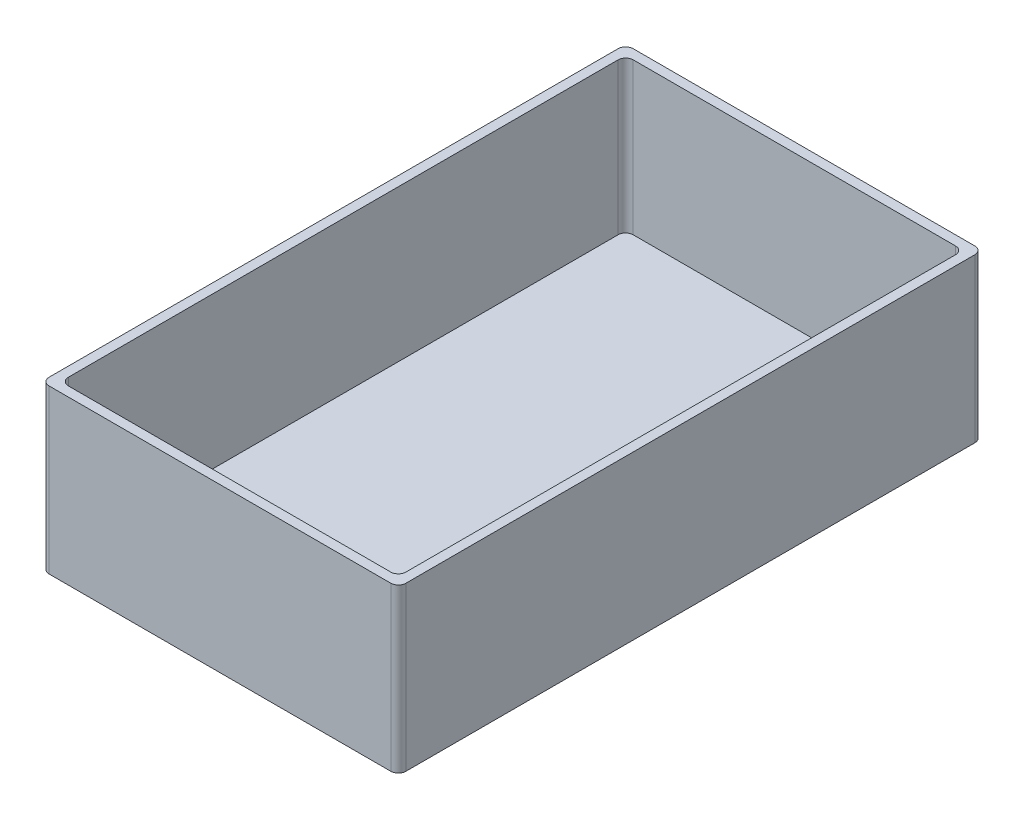
from build123d import *

# Parameters (mm, degrees)
SKETCH1_W           = 47.09116882
SKETCH1_H           = 77.09116882
BOSS_EXTRUDE1_DEPTH = 1.5
SKETCH2_W           = 47.09116882
SKETCH2_H           = 77.09116882
SKETCH2_W_2         = 44.545584412
SKETCH2_H_2         = 74.545584412
BOSS_EXTRUDE2_DEPTH = 20
FILLET4_R           = 1
SKETCH5_W           = 8.4
SKETCH5_H           = 2.6
CUT_EXTRUDE1_DEPTH  = 10
FILLET8_R           = 1
CUT_EXTRUDE2_DEPTH  = 1


with BuildPart() as part:
    # Sketch1 → Boss-Extrude1 (new body)
    with BuildSketch(Plane(origin=(0, 0, 0), x_dir=(1, 0, 0), z_dir=(0, 1, 0))):
        with Locations((23.54558441, -38.54558441)):
            Rectangle(SKETCH1_W, SKETCH1_H)
    extrude(amount=BOSS_EXTRUDE1_DEPTH)

    # Sketch2 → Boss-Extrude2 (add)
    with BuildSketch(Plane(origin=(0, 1.5, 0), x_dir=(1, 0, 0), z_dir=(0, 1, 0))):
        with Locations((23.54558441, -38.54558441)):
            Rectangle(SKETCH2_W, SKETCH2_H)
        with Locations((23.545584412, -38.545584412)):
            Rectangle(SKETCH2_W_2, SKETCH2_H_2, mode=Mode.SUBTRACT)
    extrude(amount=BOSS_EXTRUDE2_DEPTH)

    # Fillet4
    fillet4_edges = [part.edges().sort_by_distance(p)[0] for p in [
        (45.818376618, 11.5, 1.272792206),
        (1.272792206, 11.5, 1.272792206),
        (45.818376618, 11.5, 75.818376618),
        (1.272792206, 11.5, 75.818376618),
        (47.09116882, 10.75, 0),
        (0, 10.75, 0),
        (47.09116882, 10.75, 77.09116882),
        (0, 10.75, 77.09116882),
    ]]
    fillet(fillet4_edges, radius=FILLET4_R)

    # Sketch5 → Cut-Extrude1 (cut)
    with BuildSketch(Plane(origin=(0, 0, 0), x_dir=(-1, 0, 0), z_dir=(0, 0, -1))):
        with Locations((-40.003376618, 2.8)):
            Rectangle(SKETCH5_W, SKETCH5_H)
    extrude(amount=-CUT_EXTRUDE1_DEPTH, mode=Mode.SUBTRACT)

    # Fillet8
    fillet8_edges = [part.edges().sort_by_distance(p)[0] for p in [
        (35.803376618, 1.5, 0.636396103),
        (35.803376618, 4.1, 0.636396103),
        (44.203376618, 1.5, 0.636396103),
        (44.203376618, 4.1, 0.636396103),
    ]]
    fillet(fillet8_edges, radius=FILLET8_R)

    # Sketch7 → Cut-Extrude2 (cut)
    # profile 1 of 5: a face of its own
    with BuildSketch(Plane.ZY):
        with BuildLine():
            Line((23.122789015, 9.088724455), (23.122789015, 9.331051528))
            add(Edge.make_bspline(
                [(23.122789015, 9.331051528), (23.158172229, 9.332621621), (23.226621675, 9.335658995), (23.32478923, 9.348698008), (23.415271878, 9.365833728), (23.497766696, 9.389731154), (23.572170054, 9.419873563), (23.638898118, 9.455406262), (23.697605822, 9.496851961), (23.747389395, 9.546088791), (23.791713125, 9.601633591), (23.828671389, 9.665740351), (23.860744432, 9.738066215), (23.887333242, 9.818241108), (23.905169621, 9.908265731), (23.920683874, 10.005416618), (23.929529373, 10.111722199), (23.930197206, 10.185070567), (23.930545924, 10.223370488)],
                knots=[0, 0, 0, 0, 1.21933905, 2.358832743, 3.407453553, 4.388736407, 5.311689626, 6.167476111, 6.987811037, 7.776833803, 8.571160983, 9.42854077, 10.317186896, 11.293213319, 12.330560473, 13.474100807, 14.681064853, 16, 16, 16, 16], degree=3))
            Line((23.930545924, 10.223370488), (23.930545924, 13.896140183))
            add(Edge.make_bspline(
                [(23.930545924, 13.896140183), (23.930162606, 13.932333722), (23.929421448, 14.002315177), (23.920927581, 14.103216172), (23.905025382, 14.195247238), (23.887491472, 14.279961807), (23.860097102, 14.355569163), (23.829466302, 14.424460378), (23.790878128, 14.484249002), (23.747405247, 14.536947671), (23.697468763, 14.583647188), (23.638453989, 14.622324259), (23.57213896, 14.656765529), (23.4976997, 14.685648969), (23.415068701, 14.707908229), (23.324816258, 14.725482673), (23.226614113, 14.7383856), (23.158169652, 14.741442585), (23.122789015, 14.743022817)],
                knots=[0, 0, 0, 0, 1.282551141, 2.479856758, 3.582846709, 4.591957795, 5.539728447, 6.426928982, 7.258250827, 8.052375152, 8.843695357, 9.670727864, 10.544293885, 11.48842219, 12.49400259, 13.572949607, 14.745397557, 16, 16, 16, 16], degree=3))
            Line((23.122789015, 14.743022817), (23.122789015, 14.985349889))
            Line((23.122789015, 14.985349889), (26.663036092, 14.985349889))
            add(Edge.make_bspline(
                [(26.663036092, 14.985349889), (26.754786807, 14.984709338), (26.932163643, 14.983470993), (27.189430034, 14.964681567), (27.429263748, 14.937938203), (27.651615281, 14.899467764), (27.855881171, 14.848401297), (28.043717243, 14.789233969), (28.213123296, 14.715429459), (28.366123906, 14.632616561), (28.500604811, 14.537443416), (28.618378637, 14.432248928), (28.717747778, 14.315046008), (28.799350729, 14.186968175), (28.861300048, 14.047120389), (28.907143872, 13.897718054), (28.933868925, 13.736804814), (28.937019086, 13.626146569), (28.938638758, 13.569251059)],
                knots=[0, 0, 0, 0, 1.456195518, 2.815186252, 4.092612087, 5.286152587, 6.394107803, 7.433237022, 8.408414587, 9.323075695, 10.190300648, 11.017836325, 11.823384925, 12.621954132, 13.420104312, 14.244047803, 15.097168067, 16, 16, 16, 16], degree=3))
            add(Edge.make_bspline(
                [(28.938638758, 13.569251059), (28.93746323, 13.527578736), (28.935154362, 13.445729669), (28.92307528, 13.325247484), (28.899986634, 13.210535074), (28.869167468, 13.101060767), (28.825977691, 12.998472193), (28.777935777, 12.899338472), (28.717833496, 12.807218384), (28.649608415, 12.720767651), (28.571695742, 12.641543931), (28.487604462, 12.566216497), (28.393381543, 12.499725589), (28.291553396, 12.438881892), (28.182245684, 12.383196508), (28.063809698, 12.335433784), (27.937747962, 12.293639849), (27.850008588, 12.271649295), (27.805254846, 12.260432442)],
                knots=[0, 0, 0, 0, 1.057258512, 2.076573081, 3.066418169, 4.022083988, 4.955386667, 5.88594029, 6.812385758, 7.738954122, 8.674693627, 9.627316392, 10.59858209, 11.594104948, 12.634427123, 13.706444762, 14.830112694, 16, 16, 16, 16], degree=3))
            add(Edge.make_bspline(
                [(27.805254846, 12.260432442), (27.860152337, 12.246418357), (27.967531687, 12.219006843), (28.121727231, 12.166783524), (28.265931747, 12.108179154), (28.398948921, 12.040202458), (28.523193442, 11.968075486), (28.636204201, 11.886147467), (28.739714249, 11.798456232), (28.832675686, 11.702935696), (28.914908639, 11.600813333), (28.985790047, 11.491409056), (29.046446969, 11.37663561), (29.096761191, 11.255163144), (29.133501103, 11.126624694), (29.161791333, 10.992173752), (29.178445912, 10.851486491), (29.18011533, 10.755608479), (29.180965831, 10.706762513)],
                knots=[0, 0, 0, 0, 1.200236524, 2.347659523, 3.446971712, 4.495552065, 5.510781806, 6.488077221, 7.449259226, 8.382329168, 9.30821628, 10.223136563, 11.140356027, 12.055884203, 13.003743567, 13.968886504, 14.965229908, 16, 16, 16, 16], degree=3))
            add(Edge.make_bspline(
                [(29.180965831, 10.706762513), (29.178260264, 10.630371744), (29.172945188, 10.480302334), (29.124883533, 10.26213677), (29.045512554, 10.057771285), (28.936555572, 9.866928106), (28.796064874, 9.693120274), (28.626910579, 9.536702313), (28.430274638, 9.396523233), (28.283417881, 9.32162199), (28.20787118, 9.283090961)],
                knots=[0, 0, 0, 0, 1.001921625, 1.968271662, 2.916037842, 3.871050978, 4.841480686, 5.838028893, 6.887829285, 8, 8, 8, 8], degree=3))
            add(Edge.make_bspline(
                [(28.20787118, 9.283090961), (28.168990633, 9.266868615), (28.087470069, 9.232855337), (27.953916933, 9.192895156), (27.804670778, 9.161394069), (27.638994127, 9.132461927), (27.452559345, 9.113595409), (27.242992758, 9.098264779), (27.008084831, 9.0897506), (26.843104604, 9.089077871), (26.756432985, 9.088724455)],
                knots=[0, 0, 0, 0, 0.685556236, 1.437400818, 2.265017051, 3.168099556, 4.174099086, 5.314066551, 6.588956964, 8, 8, 8, 8], degree=3))
            Line((26.756432985, 9.088724455), (23.122789015, 9.088724455))
        make_face()
        with BuildLine():
            Line((25.869162505, 11.996649327), (25.869162505, 10.214535647))
            add(Edge.make_bspline(
                [(25.869162505, 10.214535647), (25.870083294, 10.157597813), (25.871812877, 10.050647459), (25.898158129, 9.902110357), (25.93479117, 9.774477738), (25.992544733, 9.6702967), (26.067367815, 9.589300761), (26.159111349, 9.531721547), (26.267470817, 9.498502949), (26.344743672, 9.494635965), (26.385369655, 9.49260291)],
                knots=[0, 0, 0, 0, 1.35076497, 2.537237249, 3.574202026, 4.491694406, 5.340337145, 6.166790864, 7.036195551, 8, 8, 8, 8], degree=3))
            add(Edge.make_bspline(
                [(26.385369655, 9.49260291), (26.416976882, 9.493559392), (26.478886908, 9.495432882), (26.569423211, 9.510550785), (26.654847514, 9.537695526), (26.735369512, 9.574099381), (26.811545485, 9.620350911), (26.882503963, 9.677914651), (26.948973401, 9.745691132), (27.009474059, 9.823670125), (27.065395319, 9.908646898), (27.111671279, 10.003295596), (27.151760003, 10.104245519), (27.186645672, 10.211851975), (27.211181658, 10.326977644), (27.228480936, 10.448883695), (27.240412589, 10.577793057), (27.241692253, 10.666346481), (27.24234925, 10.711810994)],
                knots=[0, 0, 0, 0, 0.909326651, 1.781125419, 2.631216245, 3.481910371, 4.318706169, 5.188484932, 6.104556946, 7.04432439, 8.024928682, 9.026607745, 10.069791588, 11.149570057, 12.277615897, 13.452196513, 14.691923592, 16, 16, 16, 16], degree=3))
            add(Edge.make_bspline(
                [(27.24234925, 10.711810994), (27.241645097, 10.759414737), (27.240262742, 10.852867818), (27.221652156, 10.988757253), (27.194185773, 11.117707304), (27.155578554, 11.239005379), (27.103904387, 11.352135858), (27.043917077, 11.45940864), (26.969780209, 11.5575465), (26.886540048, 11.648900594), (26.793482845, 11.730710658), (26.691564594, 11.801637345), (26.582750494, 11.862693336), (26.465892941, 11.912087413), (26.341349077, 11.94959995), (26.209294298, 11.977654584), (26.069417988, 11.994107339), (25.973541157, 11.995791378), (25.924695793, 11.996649327)],
                knots=[0, 0, 0, 0, 1.098709218, 2.156926248, 3.161356223, 4.141618498, 5.089761152, 6.029853085, 6.974353916, 7.923442149, 8.88050543, 9.829394672, 10.786408624, 11.75738002, 12.753266321, 13.786198064, 14.872157544, 16, 16, 16, 16], degree=3))
            Line((25.924695793, 11.996649327), (25.869162505, 11.996649327))
        make_face(mode=Mode.SUBTRACT)
        with BuildLine():
            Line((25.869162505, 12.400527781), (25.915860951, 12.400527781))
            add(Edge.make_bspline(
                [(25.915860951, 12.400527781), (25.958822954, 12.400961696), (26.042466766, 12.401806495), (26.163842561, 12.416800609), (26.277636374, 12.437279155), (26.38337171, 12.467746539), (26.480471641, 12.506928094), (26.570554291, 12.553529624), (26.651006691, 12.611130207), (26.7252614, 12.67527216), (26.789838956, 12.749678187), (26.846633153, 12.831106849), (26.893686833, 12.921296254), (26.932782611, 13.018453225), (26.963285953, 13.124170948), (26.983633945, 13.237563396), (26.998813421, 13.358494176), (26.999610642, 13.441724531), (27.000022177, 13.484689007)],
                knots=[0, 0, 0, 0, 1.175910238, 2.289409458, 3.344868378, 4.340505644, 5.297029594, 6.209429795, 7.110995592, 8.000998573, 8.891001555, 9.802018062, 10.714418263, 11.670942212, 12.666579478, 13.722038399, 14.824089762, 16, 16, 16, 16], degree=3))
            add(Edge.make_bspline(
                [(27.000022177, 13.484689007), (26.998860832, 13.528462467), (26.996611372, 13.613249156), (26.984796077, 13.736311429), (26.961362951, 13.850997508), (26.930873488, 13.957905169), (26.889351437, 14.056502054), (26.84095932, 14.148016992), (26.780955482, 14.229950821), (26.713374886, 14.304157954), (26.637399264, 14.370233688), (26.552323901, 14.42689159), (26.45932452, 14.475384075), (26.357647145, 14.514366818), (26.247290997, 14.544693751), (26.128475184, 14.565185083), (26.001644825, 14.580231731), (25.914226859, 14.581049745), (25.869162505, 14.581471435)],
                knots=[0, 0, 0, 0, 1.166418219, 2.259285422, 3.287915331, 4.28088229, 5.215396874, 6.133093976, 7.032054244, 7.912592253, 8.802424359, 9.706956172, 10.629295032, 11.590837296, 12.602289845, 13.672863139, 14.800350498, 16, 16, 16, 16], degree=3))
            Line((25.869162505, 14.581471435), (25.869162505, 12.400527781))
        make_face(mode=Mode.SUBTRACT)
    # profile 2 of 5: a face of its own
    with BuildSketch(Plane.ZY):
        with BuildLine():
            add(Edge.make_bspline(
                [(34.88953536, 9.567068), (34.820706496, 9.514093811), (34.688430063, 9.412287151), (34.488792527, 9.278700497), (34.299833237, 9.166500304), (34.118591825, 9.077476877), (33.941703806, 9.011109745), (33.766766513, 8.96185713), (33.590456418, 8.933795046), (33.472686363, 8.929372498), (33.414116881, 8.927173074)],
                knots=[0, 0, 0, 0, 1.271116362, 2.442852158, 3.51386586, 4.48614954, 5.39435702, 6.275862862, 7.142550967, 8, 8, 8, 8], degree=3))
            add(Edge.make_bspline(
                [(33.414116881, 8.927173074), (33.375810512, 8.928355319), (33.300676001, 8.930674188), (33.190200612, 8.942619162), (33.085401683, 8.966248151), (32.984660939, 8.995643445), (32.890452444, 9.036664988), (32.800364091, 9.08485283), (32.716509662, 9.143345354), (32.63673437, 9.208346011), (32.565602245, 9.281051155), (32.503039915, 9.358820824), (32.449406885, 9.440934627), (32.40692614, 9.52864149), (32.372030426, 9.62004655), (32.348222067, 9.716668566), (32.334360861, 9.817824912), (32.332275414, 9.886762134), (32.331217775, 9.921723767)],
                knots=[0, 0, 0, 0, 1.118273976, 2.193394226, 3.236061251, 4.249702605, 5.250775815, 6.228619106, 7.226374499, 8.229252802, 9.227612255, 10.188194015, 11.138284196, 12.082646097, 13.026688741, 13.98844658, 14.979837126, 16, 16, 16, 16], degree=3))
            add(Edge.make_bspline(
                [(32.331217775, 9.921723767), (32.33325233, 9.966467173), (32.337306802, 10.0556321), (32.367309426, 10.187310335), (32.41771994, 10.314708599), (32.486616533, 10.439581338), (32.575840119, 10.560703458), (32.684454135, 10.678803776), (32.812381021, 10.793323622), (32.960062808, 10.904598219), (33.126781009, 11.012693942), (33.313080325, 11.117651141), (33.519310554, 11.217826698), (33.744569222, 11.316319438), (33.988894684, 11.412312464), (34.253834952, 11.502446244), (34.537474769, 11.590917322), (34.734134803, 11.645485645), (34.835264192, 11.673546563)],
                knots=[0, 0, 0, 0, 0.660722837, 1.316692421, 1.983845023, 2.679321203, 3.417796412, 4.200907339, 5.045903195, 5.950902042, 6.930123642, 7.979393716, 9.107975362, 10.315906258, 11.610951656, 12.984927342, 14.449545383, 16, 16, 16, 16], degree=3))
            Line((34.835264192, 11.673546563), (34.835264192, 12.639068493))
            add(Edge.make_bspline(
                [(34.835264192, 12.639068493), (34.833810164, 12.681736409), (34.831042831, 12.762942805), (34.803787835, 12.876866744), (34.761498387, 12.977295267), (34.698122779, 13.059712736), (34.621853927, 13.127089702), (34.530391246, 13.174312372), (34.426551199, 13.204506366), (34.352516633, 13.206991882), (34.314008562, 13.20828469)],
                knots=[0, 0, 0, 0, 1.16991595, 2.226606469, 3.199270053, 4.139899228, 5.057388155, 5.972326574, 6.94533331, 8, 8, 8, 8], degree=3))
            add(Edge.make_bspline(
                [(34.314008562, 13.20828469), (34.277749528, 13.207080396), (34.208135194, 13.204768251), (34.109153303, 13.18712235), (34.019878395, 13.158097327), (33.942642713, 13.117098816), (33.878329575, 13.067530147), (33.832793629, 13.008681607), (33.802264091, 12.943883853), (33.799296321, 12.897291885), (33.797801413, 12.873822845)],
                knots=[0, 0, 0, 0, 1.277481617, 2.452658569, 3.531235879, 4.572783188, 5.522327796, 6.367733403, 7.177803971, 8, 8, 8, 8], degree=3))
            add(Edge.make_bspline(
                [(33.797801413, 12.873822845), (33.799171797, 12.859047666), (33.802495752, 12.823209527), (33.818111767, 12.761463765), (33.840230042, 12.682017859), (33.873135998, 12.590984033), (33.905430801, 12.495414792), (33.928106962, 12.402490399), (33.943140528, 12.317709857), (33.945577162, 12.263430708), (33.946731593, 12.237714279)],
                knots=[0, 0, 0, 0, 0.542356625, 1.315520582, 2.324261188, 3.560909583, 4.855978772, 6.013525553, 7.058846183, 8, 8, 8, 8], degree=3))
            add(Edge.make_bspline(
                [(33.946731593, 12.237714279), (33.944841212, 12.191605445), (33.941189207, 12.102528306), (33.904664763, 11.975902275), (33.844260397, 11.863283403), (33.759825241, 11.767277976), (33.657831573, 11.688939673), (33.539846212, 11.631969183), (33.4074749, 11.599007768), (33.314597689, 11.594900262), (33.266448821, 11.592770872)],
                knots=[0, 0, 0, 0, 1.048488319, 2.025562794, 2.973515595, 3.938475544, 4.916349185, 5.88534833, 6.903734468, 8, 8, 8, 8], degree=3))
            add(Edge.make_bspline(
                [(33.266448821, 11.592770872), (33.204781478, 11.594824707), (33.086387224, 11.598767836), (32.918513407, 11.639038225), (32.768932272, 11.703084096), (32.641630748, 11.794673256), (32.539552495, 11.908168993), (32.464180379, 12.039427238), (32.420380843, 12.189153364), (32.414860336, 12.294218964), (32.411993466, 12.348780854)],
                knots=[0, 0, 0, 0, 1.150731194, 2.209272404, 3.205679727, 4.174621779, 5.115625584, 6.038282275, 6.981255259, 8, 8, 8, 8], degree=3))
            add(Edge.make_bspline(
                [(32.411993466, 12.348780854), (32.413616095, 12.391833594), (32.416798347, 12.476267378), (32.444323751, 12.599879711), (32.490228519, 12.716742219), (32.554217014, 12.827595158), (32.635996641, 12.931878892), (32.736014314, 13.029227147), (32.852431328, 13.122129242), (32.988001496, 13.205353521), (33.137277251, 13.281981102), (33.299473297, 13.348797538), (33.47293273, 13.405343718), (33.657894494, 13.452567813), (33.855135043, 13.486565224), (34.063470067, 13.513770525), (34.283502734, 13.528530406), (34.433890137, 13.530419898), (34.510899309, 13.531387454)],
                knots=[0, 0, 0, 0, 0.776633665, 1.523111389, 2.273559461, 3.035794497, 3.825944174, 4.65851555, 5.550639308, 6.509626149, 7.525415796, 8.577782669, 9.673162541, 10.817265553, 12.021207523, 13.284689127, 14.609565459, 16, 16, 16, 16], degree=3))
            add(Edge.make_bspline(
                [(34.510899309, 13.531387454), (34.59085296, 13.529992952), (34.745464527, 13.527296314), (34.96942471, 13.511846544), (35.177003301, 13.482034404), (35.369080078, 13.444624759), (35.544585765, 13.392288336), (35.704447527, 13.329374856), (35.848978447, 13.255625471), (35.976756035, 13.168799103), (36.089168287, 13.070587742), (36.187460806, 12.960641612), (36.268390287, 12.836190437), (36.336001085, 12.700438503), (36.387130234, 12.551310357), (36.425517233, 12.390414874), (36.446312021, 12.216381497), (36.449258107, 12.096407952), (36.45077801, 12.034512932)],
                knots=[0, 0, 0, 0, 1.366480562, 2.642452195, 3.833071304, 4.948373258, 5.98338863, 6.95798552, 7.880851425, 8.750277416, 9.590958813, 10.426242966, 11.261743679, 12.120221017, 13.011546789, 13.949743926, 14.942261468, 16, 16, 16, 16], degree=3))
            Line((36.45077801, 12.034512932), (36.45077801, 9.917937407))
            add(Edge.make_bspline(
                [(36.45077801, 9.917937407), (36.451316917, 9.897309716), (36.45232062, 9.858891111), (36.458159077, 9.805055197), (36.469314416, 9.759085186), (36.485184806, 9.720589193), (36.506847061, 9.690563313), (36.533146725, 9.669605354), (36.563510389, 9.655628347), (36.585664543, 9.654658552), (36.59718395, 9.654154291)],
                knots=[0, 0, 0, 0, 1.466092045, 2.730563027, 3.839918339, 4.817363835, 5.672391858, 6.438086515, 7.187858173, 8, 8, 8, 8], degree=3))
            add(Edge.make_bspline(
                [(36.59718395, 9.654154291), (36.611078481, 9.654379695), (36.642309919, 9.654886347), (36.695333078, 9.660804445), (36.759649345, 9.669608817), (36.806704872, 9.676801665), (36.831938301, 9.680658815)],
                knots=[0, 0, 0, 0, 0.704886723, 1.584409321, 2.70464445, 4, 4, 4, 4], degree=3))
            Line((36.831938301, 9.680658815), (36.935432155, 9.611242206))
            add(Edge.make_bspline(
                [(36.935432155, 9.611242206), (36.894741855, 9.557442664), (36.816144061, 9.453522928), (36.686318936, 9.315368577), (36.553653861, 9.196910916), (36.417288186, 9.098965881), (36.277563391, 9.022206666), (36.135562229, 8.967109022), (35.990328932, 8.934265244), (35.89266155, 8.929541311), (35.843698208, 8.927173074)],
                knots=[0, 0, 0, 0, 1.209617192, 2.336508761, 3.39532878, 4.396586232, 5.342443568, 6.24807497, 7.121711847, 8, 8, 8, 8], degree=3))
            add(Edge.make_bspline(
                [(35.843698208, 8.927173074), (35.794273531, 8.928874877), (35.696896168, 8.932227799), (35.55527593, 8.966101728), (35.419697993, 9.015809471), (35.293287299, 9.089230424), (35.17485741, 9.180117052), (35.068548828, 9.292319403), (34.97039426, 9.420823023), (34.916940885, 9.517501158), (34.88953536, 9.567068)],
                knots=[0, 0, 0, 0, 0.977007658, 1.924917533, 2.868791701, 3.827730291, 4.807575413, 5.815080351, 6.879792543, 8, 8, 8, 8], degree=3))
        make_face()
        with BuildLine():
            Line((34.835264192, 9.86492836), (34.835264192, 11.3504438))
            add(Edge.make_bspline(
                [(34.835264192, 11.3504438), (34.769665886, 11.322188621), (34.641371179, 11.266928201), (34.466771823, 11.158663646), (34.312431251, 11.034144365), (34.183342708, 10.891630073), (34.078406592, 10.739050908), (34.001624878, 10.57845335), (33.955924586, 10.411410935), (33.949787906, 10.297681843), (33.946731593, 10.24104017)],
                knots=[0, 0, 0, 0, 1.134876878, 2.219549628, 3.256406399, 4.279653767, 5.267151473, 6.192194313, 7.099639888, 8, 8, 8, 8], degree=3))
            add(Edge.make_bspline(
                [(33.946731593, 10.24104017), (33.948545532, 10.199709576), (33.952039666, 10.120095792), (33.975399708, 10.006104569), (34.018012674, 9.904532168), (34.07523882, 9.816223723), (34.146705638, 9.744461281), (34.228483773, 9.69121017), (34.321059286, 9.65958021), (34.385709552, 9.655989952), (34.418764536, 9.654154291)],
                knots=[0, 0, 0, 0, 1.17807046, 2.269278925, 3.295857273, 4.300206856, 5.249812173, 6.161174972, 7.059828585, 8, 8, 8, 8], degree=3))
            add(Edge.make_bspline(
                [(34.418764536, 9.654154291), (34.458202812, 9.656477241), (34.534711589, 9.660983676), (34.645394576, 9.700080372), (34.747044862, 9.769181667), (34.804549302, 9.831592705), (34.835264192, 9.86492836)],
                knots=[0, 0, 0, 0, 0.977692352, 1.896686523, 2.876555558, 4, 4, 4, 4], degree=3))
        make_face(mode=Mode.SUBTRACT)
    # profile 3 of 5: a face of its own
    with BuildSketch(Plane.ZY):
        with BuildLine():
            add(Edge.make_bspline(
                [(41.836244775, 12.897803128), (41.890872946, 12.947693375), (41.998663423, 13.04613514), (42.173987775, 13.173123692), (42.355377401, 13.283347513), (42.544845922, 13.372287267), (42.739387776, 13.443717122), (42.937779206, 13.493794881), (43.13898224, 13.525698325), (43.274102339, 13.529485626), (43.341954138, 13.531387454)],
                knots=[0, 0, 0, 0, 1.059830533, 2.091222143, 3.097623914, 4.098516873, 5.08681074, 6.063944825, 7.027792109, 8, 8, 8, 8], degree=3))
            add(Edge.make_bspline(
                [(43.341954138, 13.531387454), (43.393749201, 13.530132095), (43.494287816, 13.527695338), (43.640171528, 13.510153245), (43.775995824, 13.480031517), (43.901674625, 13.437545011), (44.016126968, 13.381223232), (44.120984216, 13.314208012), (44.214641351, 13.233853206), (44.299032685, 13.142236788), (44.372537797, 13.037109969), (44.437234628, 12.919775856), (44.489399109, 12.788308741), (44.534195323, 12.645025312), (44.567084414, 12.488106015), (44.593050146, 12.318401152), (44.605952524, 12.135261883), (44.608043682, 12.00886518), (44.609122789, 11.94364028)],
                knots=[0, 0, 0, 0, 1.067632428, 2.072365165, 3.023409269, 3.931238047, 4.800075315, 5.646859838, 6.489726926, 7.336822285, 8.207907518, 9.127794295, 10.092501721, 11.118458463, 12.219081198, 13.394106286, 14.655272213, 16, 16, 16, 16], degree=3))
            Line((44.609122789, 11.94364028), (44.609122789, 10.140070557))
            add(Edge.make_bspline(
                [(44.609122789, 10.140070557), (44.609842206, 10.078137338), (44.611178649, 9.963085727), (44.633005126, 9.804079537), (44.664952754, 9.671167419), (44.713417974, 9.562597895), (44.780733615, 9.476031608), (44.868011736, 9.409680869), (44.974013401, 9.359811388), (45.052505046, 9.340962506), (45.093776934, 9.331051528)],
                knots=[0, 0, 0, 0, 1.41771904, 2.633657055, 3.669320692, 4.54044398, 5.336795662, 6.154275009, 7.029494719, 8, 8, 8, 8], degree=3))
            Line((45.093776934, 9.331051528), (45.093776934, 9.088724455))
            Line((45.093776934, 9.088724455), (42.589730517, 9.088724455))
            Line((42.589730517, 9.088724455), (42.589730517, 9.331051528))
            add(Edge.make_bspline(
                [(42.589730517, 9.331051528), (42.624777924, 9.341000387), (42.691449063, 9.359926232), (42.779660727, 9.409674057), (42.852008664, 9.471687778), (42.908061074, 9.551358588), (42.948833557, 9.65159468), (42.974227104, 9.777629549), (42.992151643, 9.93046654), (42.993097891, 10.041978133), (42.993608971, 10.102206952)],
                knots=[0, 0, 0, 0, 0.910150985, 1.731392072, 2.515877977, 3.279398349, 4.148763724, 5.207652683, 6.491817985, 8, 8, 8, 8], degree=3))
            Line((42.993608971, 10.102206952), (42.993608971, 12.084997739))
            add(Edge.make_bspline(
                [(42.993608971, 12.084997739), (42.99355743, 12.120348634), (42.993458584, 12.188145912), (42.987494635, 12.28487364), (42.982133094, 12.37256206), (42.972329083, 12.450619829), (42.95842102, 12.518861528), (42.942440872, 12.577268155), (42.923514892, 12.626003206), (42.895443985, 12.678609554), (42.8462227, 12.732193037), (42.766903105, 12.775317004), (42.669432978, 12.800025885), (42.598721561, 12.802874568), (42.560701753, 12.804406236)],
                knots=[0, 0, 0, 0, 1.302593196, 2.49816228, 3.570879109, 4.540218863, 5.39473672, 6.135947708, 6.769418966, 7.31763755, 8.327312717, 9.396662214, 10.600248616, 12, 12, 12, 12], degree=3))
            add(Edge.make_bspline(
                [(42.560701753, 12.804406236), (42.533279593, 12.803012153), (42.477066087, 12.80015438), (42.391081875, 12.781788767), (42.303470549, 12.749521982), (42.213672548, 12.706707644), (42.124359772, 12.651610495), (42.034315217, 12.587893481), (41.947622898, 12.510993915), (41.89151287, 12.455486804), (41.862749299, 12.427032305)],
                knots=[0, 0, 0, 0, 0.808921316, 1.658232049, 2.580544254, 3.557337308, 4.587299838, 5.672014053, 6.806609212, 8, 8, 8, 8], degree=3))
            Line((41.862749299, 12.427032305), (41.862749299, 10.059294866))
            add(Edge.make_bspline(
                [(41.862749299, 10.059294866), (41.86329928, 10.002436888), (41.864321016, 9.89680815), (41.881928752, 9.751841805), (41.908189011, 9.632075375), (41.947205542, 9.535615302), (42.002599764, 9.458946364), (42.076466447, 9.401774108), (42.164999505, 9.356439921), (42.231650331, 9.339789458), (42.266627753, 9.331051528)],
                knots=[0, 0, 0, 0, 1.477598598, 2.745030361, 3.790566088, 4.658241861, 5.432848118, 6.218805647, 7.065254079, 8, 8, 8, 8], degree=3))
            Line((42.266627753, 9.331051528), (42.266627753, 9.088724455))
            Line((42.266627753, 9.088724455), (39.762581336, 9.088724455))
            Line((39.762581336, 9.088724455), (39.762581336, 9.331051528))
            add(Edge.make_bspline(
                [(39.762581336, 9.331051528), (39.803469193, 9.342311922), (39.881082035, 9.363686267), (39.984684426, 9.415458451), (40.071836244, 9.476604119), (40.138573794, 9.554810766), (40.188879886, 9.647639356), (40.223594574, 9.757628296), (40.242896677, 9.885710141), (40.245728653, 9.976767921), (40.247235481, 10.025217621)],
                knots=[0, 0, 0, 0, 1.087645405, 2.064555523, 2.962175542, 3.805522198, 4.681515997, 5.659562649, 6.754708406, 8, 8, 8, 8], degree=3))
            Line((40.247235481, 10.025217621), (40.247235481, 12.487614073))
            add(Edge.make_bspline(
                [(40.247235481, 12.487614073), (40.245738537, 12.535221725), (40.242941073, 12.62419008), (40.223824241, 12.748611468), (40.188871063, 12.854044611), (40.138730883, 12.941707943), (40.071865287, 13.01383549), (39.984072308, 13.06578435), (39.88041477, 13.107608913), (39.803380434, 13.120618717), (39.762581336, 13.127508999)],
                knots=[0, 0, 0, 0, 1.267626589, 2.368918573, 3.339570857, 4.208008789, 5.040065717, 5.925886291, 6.901503251, 8, 8, 8, 8], degree=3))
            Line((39.762581336, 13.127508999), (39.762581336, 13.369836072))
            Line((39.762581336, 13.369836072), (41.808478131, 13.369836072))
            Line((41.808478131, 13.369836072), (41.836244775, 12.897803128))
        make_face()
    # profile 4 of 5: a face of its own
    with BuildSketch(Plane.ZY):
        with BuildLine():
            add(Edge.make_bspline(
                [(50.748075295, 14.127108174), (50.746492698, 14.170078452), (50.743494243, 14.251491717), (50.72492173, 14.365686827), (50.688893284, 14.463173721), (50.638942472, 14.545390433), (50.571230577, 14.614037733), (50.485144391, 14.668965741), (50.380943911, 14.713474002), (50.304159488, 14.732779953), (50.26342115, 14.743022817)],
                knots=[0, 0, 0, 0, 1.186901705, 2.248753046, 3.178703135, 4.039400903, 4.885472661, 5.816582831, 6.84157773, 8, 8, 8, 8], degree=3))
            Line((50.26342115, 14.743022817), (50.26342115, 14.985349889))
            Line((50.26342115, 14.985349889), (52.363589113, 14.985349889))
            Line((52.363589113, 14.985349889), (52.363589113, 10.259971973))
            add(Edge.make_bspline(
                [(52.363589113, 10.259971973), (52.365045765, 10.22368943), (52.367851304, 10.153808623), (52.389239465, 10.053688287), (52.426437471, 9.964188387), (52.477391304, 9.883485707), (52.547213242, 9.814627047), (52.631454496, 9.752083944), (52.73364161, 9.698244794), (52.808780505, 9.669336731), (52.848243258, 9.654154291)],
                knots=[0, 0, 0, 0, 1.037498224, 1.998239547, 2.910099798, 3.79806014, 4.708648841, 5.697911169, 6.790948923, 8, 8, 8, 8], degree=3))
            Line((52.848243258, 9.654154291), (52.848243258, 9.411827219))
            Line((52.848243258, 9.411827219), (51.276903646, 8.927173074))
            Line((51.276903646, 8.927173074), (50.774579819, 8.927173074))
            Line((50.774579819, 8.927173074), (50.774579819, 9.34998333))
            add(Edge.make_bspline(
                [(50.774579819, 9.34998333), (50.740348384, 9.315170038), (50.672927028, 9.246602671), (50.56103871, 9.157587134), (50.441893332, 9.084054232), (50.315211579, 9.025200118), (50.179190262, 8.980640938), (50.032345795, 8.949711333), (49.873935134, 8.930484047), (49.764520368, 8.928299686), (49.708088275, 8.927173074)],
                knots=[0, 0, 0, 0, 0.988780494, 1.947476663, 2.889189876, 3.819916673, 4.771649822, 5.783358552, 6.856738262, 8, 8, 8, 8], degree=3))
            add(Edge.make_bspline(
                [(49.708088275, 8.927173074), (49.641501256, 8.929084841), (49.511457722, 8.932818498), (49.321491629, 8.962879441), (49.141806098, 9.010265289), (48.972055455, 9.07762415), (48.813558999, 9.165150306), (48.666002579, 9.272821576), (48.52787914, 9.397944401), (48.40155753, 9.542547895), (48.288884857, 9.703693812), (48.189343578, 9.879237857), (48.106679389, 10.069023031), (48.038240872, 10.272112062), (47.985467142, 10.488773497), (47.948184439, 10.718753335), (47.924923586, 10.962494167), (47.922283539, 11.12951857), (47.920926115, 11.215396942)],
                knots=[0, 0, 0, 0, 0.977602, 1.909243285, 2.817599713, 3.702317487, 4.584614925, 5.469634776, 6.379545279, 7.31662202, 8.283541241, 9.26309431, 10.275768339, 11.3192704, 12.407360543, 13.547194767, 14.738849437, 16, 16, 16, 16], degree=3))
            add(Edge.make_bspline(
                [(47.920926115, 11.215396942), (47.922466055, 11.29999752), (47.925474451, 11.465271557), (47.946420783, 11.707086047), (47.984630059, 11.935977467), (48.036280585, 12.152382645), (48.101040916, 12.357031605), (48.18435849, 12.548007139), (48.279220279, 12.72819113), (48.391095169, 12.892798535), (48.511571756, 13.043492651), (48.645563752, 13.17241362), (48.786486634, 13.28397891), (48.937025145, 13.375569993), (49.097686797, 13.44548683), (49.267407026, 13.494510044), (49.445673923, 13.525857956), (49.567861285, 13.529526636), (49.629836825, 13.531387454)],
                knots=[0, 0, 0, 0, 1.261256385, 2.46396585, 3.61470641, 4.71763578, 5.778809929, 6.809919457, 7.820099768, 8.809921961, 9.772849717, 10.691002313, 11.575570478, 12.447935574, 13.310231442, 14.179547288, 15.076634956, 16, 16, 16, 16], degree=3))
            add(Edge.make_bspline(
                [(49.629836825, 13.531387454), (49.685449028, 13.52998527), (49.794629237, 13.527232444), (49.954115813, 13.504065203), (50.105603274, 13.46620355), (50.249160927, 13.412977206), (50.385278024, 13.344061983), (50.514358835, 13.260417064), (50.637117657, 13.161380001), (50.710604113, 13.084614417), (50.748075295, 13.045471188)],
                knots=[0, 0, 0, 0, 1.060885032, 2.082773998, 3.068084488, 4.035969666, 4.998244255, 5.973659146, 6.966756713, 8, 8, 8, 8], degree=3))
            Line((50.748075295, 13.045471188), (50.748075295, 14.127108174))
        make_face()
        with BuildLine():
            add(Edge.make_bspline(
                [(50.748075295, 12.519167077), (50.733323228, 12.541316419), (50.704504385, 12.584586177), (50.655704991, 12.643382291), (50.600153018, 12.691759177), (50.541040337, 12.732484906), (50.476388524, 12.764394634), (50.407608529, 12.789028356), (50.332400724, 12.801008858), (50.281122928, 12.803247647), (50.254586309, 12.804406236)],
                knots=[0, 0, 0, 0, 1.067726308, 2.085852473, 3.054633921, 4.01454897, 4.958294611, 5.940660842, 6.934277559, 8, 8, 8, 8], degree=3))
            add(Edge.make_bspline(
                [(50.254586309, 12.804406236), (50.231394831, 12.802947461), (50.185694865, 12.800072871), (50.118743836, 12.784651159), (50.058909417, 12.752138824), (50.001904859, 12.711923502), (49.952035408, 12.657732692), (49.905483085, 12.593127952), (49.864619411, 12.516652077), (49.829555943, 12.427862445), (49.79732802, 12.327290917), (49.772327298, 12.211663038), (49.74719383, 12.082344899), (49.731442253, 11.937892795), (49.715152016, 11.779840083), (49.706113215, 11.607154773), (49.699516402, 11.41991226), (49.69851263, 11.290289983), (49.697991314, 11.222969663)],
                knots=[0, 0, 0, 0, 0.611005145, 1.204016161, 1.78787458, 2.389797393, 3.03148395, 3.71312863, 4.480432672, 5.304278075, 6.221019481, 7.254263712, 8.413036429, 9.68375761, 11.073060773, 12.591350665, 14.229691898, 16, 16, 16, 16], degree=3))
            add(Edge.make_bspline(
                [(49.697991314, 11.222969663), (49.698519516, 11.153546223), (49.69953773, 11.019718688), (49.70602165, 10.827424152), (49.715159653, 10.650956774), (49.731437439, 10.490802799), (49.746851396, 10.345870091), (49.772296915, 10.217840396), (49.797281892, 10.105167597), (49.82883522, 10.007848793), (49.86625042, 9.924465198), (49.906763738, 9.851598306), (49.955933775, 9.791586592), (50.009374348, 9.741209108), (50.069311564, 9.701315784), (50.135738737, 9.673638229), (50.207449133, 9.656570705), (50.257013622, 9.654971744), (50.282352953, 9.654154291)],
                knots=[0, 0, 0, 0, 1.808176025, 3.48562019, 5.011280201, 6.409124091, 7.678579057, 8.804733467, 9.806761663, 10.683457156, 11.463390438, 12.185111923, 12.847404209, 13.47545179, 14.092408216, 14.711113773, 15.341070318, 16, 16, 16, 16], degree=3))
            add(Edge.make_bspline(
                [(50.282352953, 9.654154291), (50.327699087, 9.656359671), (50.41722191, 9.660713556), (50.544095468, 9.701828558), (50.658458681, 9.763239655), (50.718569952, 9.822982604), (50.748075295, 9.852307158)],
                knots=[0, 0, 0, 0, 1.041701315, 2.05653789, 3.046060495, 4, 4, 4, 4], degree=3))
            Line((50.748075295, 9.852307158), (50.748075295, 12.519167077))
        make_face(mode=Mode.SUBTRACT)
    # profile 5 of 5: a face of its own
    with BuildSketch(Plane.ZY):
        with BuildLine():
            Line((54.230058402, 16.165393271), (54.230058402, 16.297571675))
            add(Edge.make_bspline(
                [(54.230058402, 16.297571675), (54.248328494, 16.298665964), (54.28397792, 16.300801191), (54.335938503, 16.308685121), (54.385095221, 16.320062641), (54.431668993, 16.334593221), (54.475920172, 16.351768942), (54.516718895, 16.373914303), (54.555078566, 16.398520213), (54.590314737, 16.426587888), (54.622187127, 16.457171704), (54.649768542, 16.490527661), (54.673004439, 16.52572953), (54.6925393, 16.562805125), (54.707277924, 16.60206499), (54.718455404, 16.643326324), (54.724522255, 16.686696028), (54.725322222, 16.716291583), (54.725727415, 16.73128206)],
                knots=[0, 0, 0, 0, 1.196703393, 2.335061643, 3.432840152, 4.493928574, 5.524540636, 6.53176905, 7.524741272, 8.502277752, 9.473571254, 10.409039698, 11.327003312, 12.228317725, 13.144069708, 14.0643085, 15.019550807, 16, 16, 16, 16], degree=3))
            add(Edge.make_bspline(
                [(54.725727415, 16.73128206), (54.724663049, 16.755686759), (54.722589287, 16.803235756), (54.702603287, 16.871448922), (54.670072506, 16.93336101), (54.625573304, 16.987845504), (54.572304559, 17.032915703), (54.512333453, 17.067472835), (54.445302647, 17.086655319), (54.398836968, 17.08929577), (54.375144853, 17.090642094)],
                knots=[0, 0, 0, 0, 1.045921343, 2.037825291, 3.023042605, 4.031929546, 5.038865269, 6.005159095, 6.982862143, 8, 8, 8, 8], degree=3))
            add(Edge.make_bspline(
                [(54.375144853, 17.090642094), (54.355124396, 17.08997905), (54.31530335, 17.088660244), (54.256319216, 17.076988683), (54.198046108, 17.059764732), (54.140953322, 17.033820604), (54.084435148, 17.001090465), (54.028598027, 16.960962697), (53.972911202, 16.913716034), (53.937876992, 16.877875273), (53.919748948, 16.859329889)],
                knots=[0, 0, 0, 0, 0.913045861, 1.816064483, 2.735678497, 3.681794251, 4.670939184, 5.713053229, 6.816645983, 8, 8, 8, 8], degree=3))
            Line((53.919748948, 16.859329889), (53.833523193, 16.902184605))
            add(Edge.make_bspline(
                [(53.833523193, 16.902184605), (53.846497364, 16.9230242), (53.872102599, 16.964152279), (53.914874886, 17.021883781), (53.959071214, 17.076227314), (54.005778134, 17.126626339), (54.054916976, 17.173000936), (54.105990216, 17.216170791), (54.159770258, 17.254851433), (54.215787324, 17.289465278), (54.273594061, 17.320627333), (54.333534684, 17.347372632), (54.395242649, 17.370277184), (54.458765427, 17.388769851), (54.524121504, 17.403332096), (54.59139574, 17.41356181), (54.660547594, 17.419924839), (54.707298238, 17.420697955), (54.730890633, 17.421088102)],
                knots=[0, 0, 0, 0, 1.083115992, 2.137588543, 3.168623907, 4.173812685, 5.167917667, 6.149315576, 7.123365182, 8.088845794, 9.054057398, 10.019747185, 10.983552756, 11.957128285, 12.937643775, 13.936815215, 14.958827809, 16, 16, 16, 16], degree=3))
            add(Edge.make_bspline(
                [(54.730890633, 17.421088102), (54.754491736, 17.42081007), (54.800607943, 17.4202668), (54.868032807, 17.412556787), (54.932054512, 17.401378398), (54.993027623, 17.386092472), (55.050500046, 17.365252073), (55.104734174, 17.339976768), (55.15578674, 17.310359021), (55.203064851, 17.276543826), (55.245771649, 17.238833951), (55.283815226, 17.198769374), (55.315521319, 17.155466617), (55.34160686, 17.109761129), (55.36171162, 17.061513473), (55.376546934, 17.010841982), (55.384622364, 16.957345535), (55.385945578, 16.920797067), (55.386619431, 16.902184605)],
                knots=[0, 0, 0, 0, 1.21104475, 2.366363565, 3.479135549, 4.546388473, 5.588921467, 6.612751613, 7.614495833, 8.61495324, 9.591638542, 10.535600516, 11.44574907, 12.340061726, 13.231138385, 14.123222084, 15.044242923, 16, 16, 16, 16], degree=3))
            add(Edge.make_bspline(
                [(55.386619431, 16.902184605), (55.385739598, 16.880248181), (55.383976032, 16.836278114), (55.36911607, 16.771236467), (55.346475605, 16.706979364), (55.313665067, 16.64492128), (55.272755574, 16.585168471), (55.223153592, 16.529428887), (55.16635049, 16.47675787), (55.12349272, 16.446322749), (55.101609749, 16.430782722)],
                knots=[0, 0, 0, 0, 0.91699412, 1.83805225, 2.77891915, 3.761454603, 4.766332753, 5.802297062, 6.877863427, 8, 8, 8, 8], degree=3))
            add(Edge.make_bspline(
                [(55.101609749, 16.430782722), (55.131403576, 16.412259068), (55.189643747, 16.37604953), (55.266676349, 16.309760459), (55.333620653, 16.236871966), (55.388192462, 16.155801871), (55.432052791, 16.069374456), (55.463086359, 15.977592636), (55.48235379, 15.881187892), (55.484608502, 15.815245487), (55.485753233, 15.781766109)],
                knots=[0, 0, 0, 0, 1.06257741, 2.077097667, 3.071068378, 4.05549622, 5.031209619, 6.001757847, 6.985479743, 8, 8, 8, 8], degree=3))
            add(Edge.make_bspline(
                [(55.485753233, 15.781766109), (55.484938359, 15.750039185), (55.483335181, 15.687619815), (55.46830624, 15.596009965), (55.444330378, 15.508392137), (55.409610963, 15.425106592), (55.366172623, 15.345581666), (55.312499362, 15.270310154), (55.249009491, 15.199502369), (55.177047008, 15.133091933), (55.097384971, 15.07336558), (55.012355011, 15.020039666), (54.921722292, 14.975786012), (54.825948588, 14.939446216), (54.725063804, 14.91102558), (54.618809931, 14.8910502), (54.507428072, 14.879042683), (54.431454102, 14.877460772), (54.392699797, 14.87665384)],
                knots=[0, 0, 0, 0, 0.960421021, 1.88952684, 2.804037308, 3.706370315, 4.616337066, 5.543598054, 6.499992016, 7.492479456, 8.504935626, 9.511819415, 10.528388038, 11.554735485, 12.611021461, 13.698946738, 14.826233272, 16, 16, 16, 16], degree=3))
            add(Edge.make_bspline(
                [(54.392699797, 14.87665384), (54.368252254, 14.876930999), (54.320687677, 14.877470234), (54.251248959, 14.882231771), (54.185553627, 14.889782427), (54.12358386, 14.900841234), (54.065049629, 14.913693376), (54.010777734, 14.931219874), (53.959801061, 14.950280694), (53.913708758, 14.97383297), (53.871501905, 14.998566231), (53.835450356, 15.026861967), (53.803824403, 15.055919456), (53.779042363, 15.088001485), (53.758620045, 15.12132442), (53.745085504, 15.157288614), (53.73549746, 15.194898448), (53.734762312, 15.220806222), (53.73438939, 15.233948586)],
                knots=[0, 0, 0, 0, 1.420393226, 2.763484417, 4.042380758, 5.260682684, 6.420270788, 7.520966141, 8.572117318, 9.578402006, 10.525131305, 11.40926028, 12.236891626, 13.013142092, 13.757493871, 14.498479048, 15.238316091, 16, 16, 16, 16], degree=3))
            add(Edge.make_bspline(
                [(53.73438939, 15.233948586), (53.735211369, 15.248136802), (53.736803564, 15.275619763), (53.748424624, 15.315108671), (53.768696482, 15.350309461), (53.79605614, 15.381305861), (53.82968029, 15.406271207), (53.867525883, 15.425629045), (53.910042312, 15.436424898), (53.939655929, 15.43773796), (53.954858836, 15.438412054)],
                knots=[0, 0, 0, 0, 1.013200655, 1.962597261, 2.909840947, 3.894349925, 4.895387226, 5.885334463, 6.914382381, 8, 8, 8, 8], degree=3))
            add(Edge.make_bspline(
                [(53.954858836, 15.438412054), (53.967469088, 15.43795508), (53.992790464, 15.437037478), (54.030134021, 15.428290996), (54.066693478, 15.414682195), (54.102999705, 15.395684939), (54.139675463, 15.370120151), (54.177812807, 15.337940421), (54.217611057, 15.298352831), (54.243664299, 15.268708288), (54.257423462, 15.253052496)],
                knots=[0, 0, 0, 0, 0.824328205, 1.655250527, 2.496495261, 3.373273502, 4.329471496, 5.417070829, 6.635910792, 8, 8, 8, 8], degree=3))
            add(Edge.make_bspline(
                [(54.257423462, 15.253052496), (54.26453405, 15.244836229), (54.281179172, 15.225602833), (54.296933464, 15.205631582), (54.30595772, 15.194191801)],
                knots=[0, 0, 0, 0, 0.854375018, 2, 2, 2, 2], degree=3))
            add(Edge.make_bspline(
                [(54.30595772, 15.194191801), (54.318176683, 15.179580027), (54.341565828, 15.15161064), (54.37784246, 15.113928074), (54.412690368, 15.081334105), (54.44761104, 15.055798737), (54.480553914, 15.034318447), (54.513144843, 15.019811942), (54.544898216, 15.0109554), (54.565788956, 15.009529026), (54.575994067, 15.008832243)],
                knots=[0, 0, 0, 0, 1.354964605, 2.593629504, 3.720639236, 4.744509104, 5.668828852, 6.51317621, 7.273687655, 8, 8, 8, 8], degree=3))
            add(Edge.make_bspline(
                [(54.575994067, 15.008832243), (54.587883029, 15.009291314), (54.611451289, 15.010201361), (54.646152513, 15.015558873), (54.679157494, 15.026565979), (54.711034663, 15.040124986), (54.741459104, 15.05813185), (54.770447574, 15.079856752), (54.797924675, 15.105900252), (54.832030717, 15.145927495), (54.869748244, 15.201904054), (54.901055254, 15.278137409), (54.920951361, 15.361498487), (54.922958346, 15.419705368), (54.923995019, 15.449771135)],
                knots=[0, 0, 0, 0, 0.686440473, 1.360775508, 2.017247623, 2.688871089, 3.356591233, 4.051812904, 4.775467999, 5.536008317, 7.084085645, 8.646433608, 10.267772751, 12, 12, 12, 12], degree=3))
            add(Edge.make_bspline(
                [(54.923995019, 15.449771135), (54.92343344, 15.473384113), (54.92233035, 15.519766246), (54.912598729, 15.588029674), (54.897440748, 15.653901849), (54.874802549, 15.71698378), (54.846931842, 15.778075352), (54.812191021, 15.836183945), (54.771500324, 15.892090939), (54.724830862, 15.944643027), (54.673771027, 15.993271356), (54.619299487, 16.036524858), (54.561721668, 16.073445523), (54.500994773, 16.103801846), (54.437704299, 16.128953152), (54.37124262, 16.147464085), (54.301720376, 16.160002214), (54.254201578, 16.163577005), (54.230058402, 16.165393271)],
                knots=[0, 0, 0, 0, 1.027838958, 2.018947511, 2.997046879, 3.966608266, 4.932454178, 5.917108152, 6.909576173, 7.939735466, 8.973569294, 9.97676275, 10.964379125, 11.946519473, 12.929174496, 13.925794353, 14.946145252, 16, 16, 16, 16], degree=3))
        make_face()
    extrude(amount=-CUT_EXTRUDE2_DEPTH, mode=Mode.SUBTRACT)


solid = part.part
